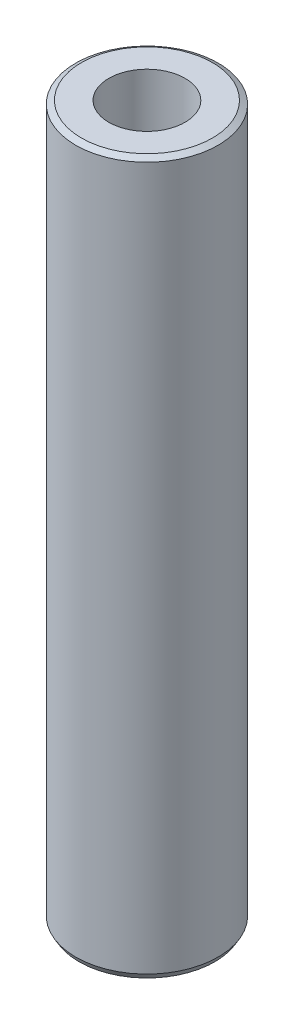
from build123d import *
from OCP.BRepFilletAPI import BRepFilletAPI_MakeChamfer

# Parameters (mm, degrees)
SKETCH1_R           = 60
BOSS_EXTRUDE1_DEPTH = 600
SKETCH2_R           = 32.124852838
CUT_EXTRUDE1_DEPTH  = 606.970296302
CHAMFER1_SIZE       = 2.804586981
CHAMFER1_SIZE2      = 4.857687145


with BuildPart() as part:
    # Sketch1 → Boss-Extrude1 (new body)
    with BuildSketch(Plane(origin=(0, 0, 0), x_dir=(1, 0, 0), z_dir=(0, 1, 0))):
        Circle(SKETCH1_R)
    extrude(amount=BOSS_EXTRUDE1_DEPTH)

    # Sketch2 → Cut-Extrude1 (cut, through all)
    with BuildSketch(Plane(origin=(0, 0, 0), x_dir=(1, 0, 0), z_dir=(0, 1, 0))):
        Circle(SKETCH2_R)
    extrude(amount=CUT_EXTRUDE1_DEPTH, mode=Mode.SUBTRACT)

    # Chamfer1: one chamfer whose edges measure the first distance from different faces: ONE call of the kernel's chamfer builder (chamfer() names one face for all edges)
    chamfer1_edges_1 = [part.edges().sort_by_distance(p)[0] for p in [
        (-60, 600, 0),
    ]]
    chamfer1_side_1 = [part.faces().sort_by_distance(p)[0] for p in [
        (-60, 300, 0),
    ]]
    chamfer1_edges_2 = [part.edges().sort_by_distance(p)[0] for p in [
        (-60, 0, 0),
    ]]
    chamfer1_side_2 = [part.faces().sort_by_distance(p)[0] for p in [
        (-58.302943725, 0, 0),
    ]]
    chamfer1 = BRepFilletAPI_MakeChamfer(part.part.solid().wrapped)
    for e in chamfer1_edges_1:
        chamfer1.Add(CHAMFER1_SIZE, CHAMFER1_SIZE2, e.wrapped, chamfer1_side_1[0].wrapped)  # the first distance lies on this face
    for e in chamfer1_edges_2:
        chamfer1.Add(CHAMFER1_SIZE, CHAMFER1_SIZE2, e.wrapped, chamfer1_side_2[0].wrapped)  # the first distance lies on this face
    add(Compound.cast(chamfer1.Shape()), mode=Mode.REPLACE)


solid = part.part
